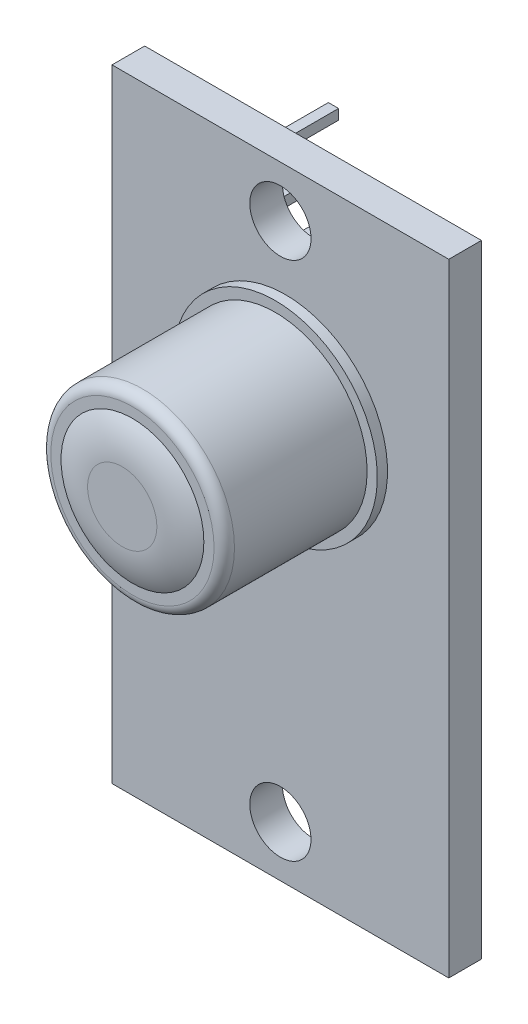
from build123d import *

# Parameters (mm, degrees)
SKETCH1_W          = 16.5
SKETCH1_H          = 30.5
SKETCH1_R          = 1.5
EXTRUDE1_DEPTH     = 1.6
EXTRUDE2_START     = 0.5
SKETCH2_R          = 4.5
EXTRUDE2_DEPTH     = 8
SKETCH3_R          = 4.5
SKETCH3_R_2        = 3.5
CUT_EXTRUDE1_DEPTH = 0.5
FILLET2_R          = 3.5
FILLET3_R          = 0.5
SKETCH4_R          = 5
EXTRUDE3_DEPTH     = 0.5
SKETCH5_W          = 2.5
SKETCH5_H          = 23
EXTRUDE4_DEPTH     = 1.5
SKETCH6_W          = 0.5
SKETCH6_H          = 0.5
EXTRUDE5_DEPTH     = 6


with BuildPart() as part:
    # Sketch1 → Extrude1 (new body)
    with BuildSketch(Plane.XY):
        Rectangle(SKETCH1_W, SKETCH1_H)
        with Locations((0, 12.75)):
            Circle(SKETCH1_R, mode=Mode.SUBTRACT)
        with Locations(Location((0, -12.75, 0), (0, 0, 180))):
            Circle(SKETCH1_R, mode=Mode.SUBTRACT)
    extrude(amount=EXTRUDE1_DEPTH)

    # Sketch5 → Extrude4 (add)
    with BuildSketch(Plane(origin=(0, 0, 0), x_dir=(-1, 0, 0), z_dir=(0, 0, -1))):
        with Locations((6.5, 0.25)):
            Rectangle(SKETCH5_W, SKETCH5_H)
    extrude(amount=EXTRUDE4_DEPTH)

    # Sketch6 → Extrude5 (add)
    with BuildSketch(Plane(origin=(0, 0, -1.5), x_dir=(-1, 0, 0), z_dir=(0, 0, -1))):
        with Locations((6.5, 9.6)):
            Rectangle(SKETCH6_W, SKETCH6_H)
        with Locations((6.5, 7.2)):
            Rectangle(SKETCH6_W, SKETCH6_H)
        with Locations((6.5, 4.8)):
            Rectangle(SKETCH6_W, SKETCH6_H)
        with Locations((6.5, 2.4)):
            Rectangle(SKETCH6_W, SKETCH6_H)
        with Locations((6.5, 0)):
            Rectangle(SKETCH6_W, SKETCH6_H)
        with Locations((6.5, -2.4)):
            Rectangle(SKETCH6_W, SKETCH6_H)
        with Locations((6.5, -4.8)):
            Rectangle(SKETCH6_W, SKETCH6_H)
        with Locations((6.5, -7.2)):
            Rectangle(SKETCH6_W, SKETCH6_H)
        with Locations((6.5, -9.6)):
            Rectangle(SKETCH6_W, SKETCH6_H)
    extrude(amount=EXTRUDE5_DEPTH)


with BuildPart() as body_2:
    # Sketch2 → Extrude2 (new body)
    with BuildSketch(Plane.XY.offset(1.6).offset(EXTRUDE2_START)):
        with Locations((0.75, 5.25)):
            Circle(SKETCH2_R)
    extrude(amount=EXTRUDE2_DEPTH)

    # Sketch3 → Cut-Extrude1 (cut)
    with BuildSketch(Plane.XY.offset(10.1)):
        with Locations((0.75, 5.25)):
            Circle(SKETCH3_R)
        with Locations((0.75, 5.25)):
            Circle(SKETCH3_R_2, mode=Mode.SUBTRACT)
    extrude(amount=-CUT_EXTRUDE1_DEPTH, mode=Mode.SUBTRACT)

    # Fillet2
    # the kernel refuses this fillet: 3.5 mm, written as the material it takes off along each edge
    with BuildSketch(Plane(origin=(0.75, 5.25, 10.1), x_dir=(1, 0, 0), z_dir=(0, -1, 0))) as fillet2_piece_1:
        with BuildLine():
            CenterArc((1.697224362, -3.5), FILLET2_R, 58.997280866, 31.002719134)
            Line((1.697224362, 0), (1.697224362, 0.07))
            Line((1.697224362, 0.07), (3.5, 0.07))
            Line((3.5, 0.07), (3.57, 0))
            ThreePointArc((3.57, 0), (3.57, -0.25), (3.536055513, -0.44))
            Line((3.536055513, -0.44), (3.5, -0.5))
        make_face()
    revolve(axis=Axis((0.75, 5.25, 10.1), (0, 0, 1)), mode=Mode.SUBTRACT)

    # Fillet3
    fillet3_edges = [body_2.edges().sort_by_distance(p)[0] for p in [
        (-3.75, 5.25, 9.6),
    ]]
    fillet(fillet3_edges, radius=FILLET3_R)

    # Sketch4 → Extrude3 (add)
    with BuildSketch(Plane(origin=(0, 0, 2.1), x_dir=(-1, 0, 0), z_dir=(0, 0, -1))):
        with Locations((-0.75, 5.25)):
            Circle(SKETCH4_R)
    extrude(amount=-EXTRUDE3_DEPTH)


solid = Compound([part.part, body_2.part])
